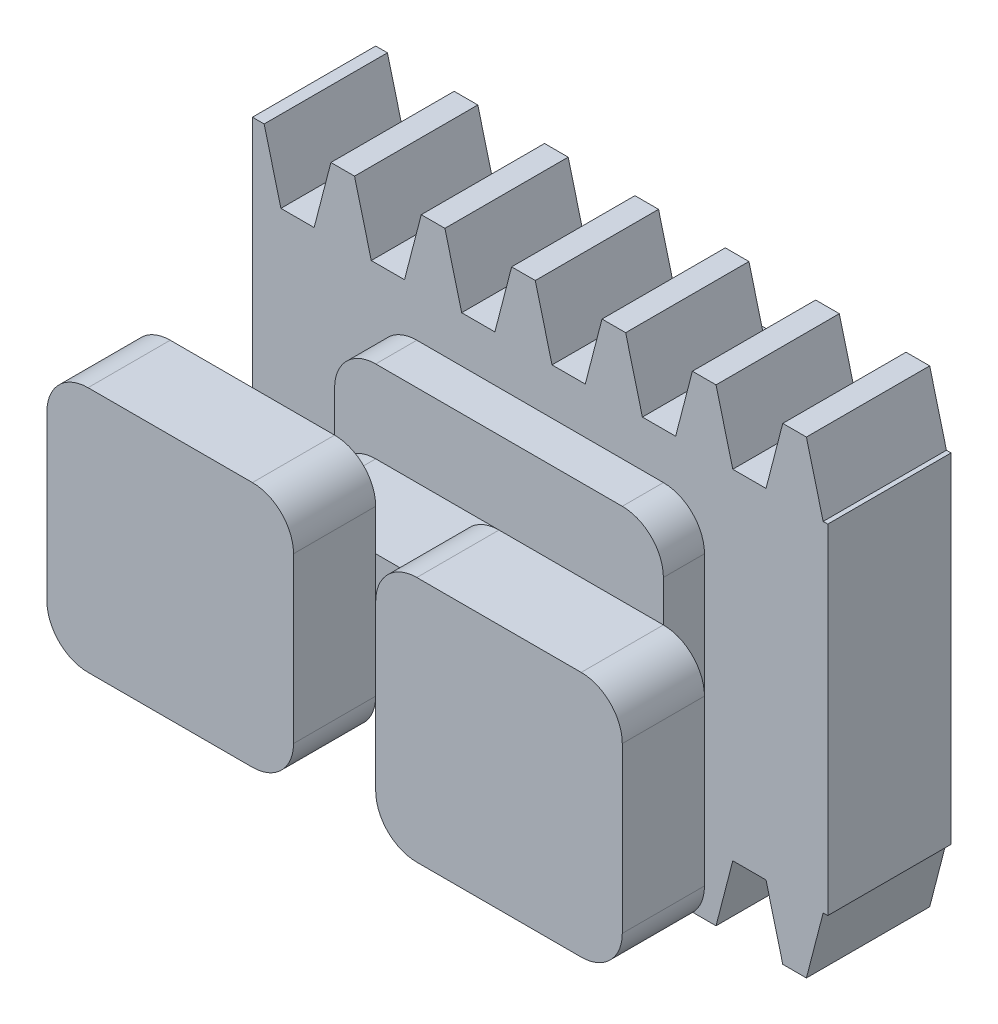
from build123d import *

# Parameters (mm, degrees)
BLANKSKE_W             = 25
BLANKSKE_H             = 5.7
BLANK_DEPTH            = 3
TOOTHCUTSIM_DEPTH      = 26.816467613
TEETHCUTS_COUNT        = 12
TEETHCUTS_PITCH        = 2.199114855
MIRROR_2_COPY_1_DEPTH  = 26.816467613
MIRROR_2_COPY_2_DEPTH  = 26.816467613
MIRROR_2_COPY_3_DEPTH  = 26.816467613
MIRROR_2_COPY_4_DEPTH  = 26.816467613
MIRROR_2_COPY_5_DEPTH  = 26.816467613
MIRROR_2_COPY_6_DEPTH  = 26.816467613
MIRROR_2_COPY_7_DEPTH  = 26.816467613
MIRROR_2_COPY_8_DEPTH  = 26.816467613
MIRROR_2_COPY_9_DEPTH  = 26.816467613
MIRROR_2_COPY_10_DEPTH = 26.816467613
MIRROR_2_COPY_11_DEPTH = 26.816467613
SKETCH_2_R             = 2
EXTRUDE_1_DEPTH        = 2.5
SKETCH_3_R             = 0.5
CUT_EXTRUDE_3_DEPTH    = 27.224797425
CUT_EXTRUDE_4_DEPTH    = 10
SKETCH_6_W             = 8
SKETCH_6_H             = 2
EXTRUDE_3_DEPTH        = 3
SKETCH_7_W             = 6
SKETCH_7_H             = 6
EXTRUDE_4_DEPTH        = 2
FILLET_1_R             = 1
FILLET_2_R             = 1
SKETCH_8_W             = 8
SKETCH_8_H             = 6
EXTRUDE_5_DEPTH        = 1
FILLET_5_R             = 1
CUT_EXTRUDE_5_DEPTH    = 24.274077912
SKETCH_10_R            = 1
CUT_EXTRUDE_6_DEPTH    = 5.5


with BuildPart() as part:
    # BlankSke → Blank (new body)
    with BuildSketch(Plane.XY):
        with Locations((12.5, 2.85)):
            Rectangle(BLANKSKE_W, BLANKSKE_H)
    blank = extrude(amount=-BLANK_DEPTH)

    # TooCutSkeSim → ToothCutSim (cut, through all)
    with BuildSketch(Plane.XY):
        Polygon((0.404488327, 4.125), (-0.404488327, 4.125), (-0.818379909, 5.7254), (0.818379909, 5.7254), align=None)
    toothcutsim = extrude(amount=-TOOTHCUTSIM_DEPTH, mode=Mode.SUBTRACT)

    # TeethCuts: ToothCutSim ×12
    with Locations(*[(i * TEETHCUTS_PITCH, 0, 0) for i in range(1, TEETHCUTS_COUNT)]):
        add(toothcutsim, mode=Mode.SUBTRACT)

    # 镜向2: Blank, ToothCutSim across plane
    add(blank.mirror(Plane(origin=(0, 0, -3), x_dir=(0, 0, 1), z_dir=(0, -1, 0))))
    add(toothcutsim.mirror(Plane(origin=(0, 0, -3), x_dir=(0, 0, 1), z_dir=(0, -1, 0))), mode=Mode.SUBTRACT)

    # 镜向2 copy 1 sketch → 镜向2 copy 1 (cut, through all)
    with BuildSketch(Plane(origin=(2.199114855, 0, 0), x_dir=(1, 0, 0), z_dir=(0, 0, 1))):
        Polygon((0.404488327, -4.125), (-0.404488327, -4.125), (-0.818379909, -5.7254), (0.818379909, -5.7254), align=None)
    extrude(amount=-MIRROR_2_COPY_1_DEPTH, mode=Mode.SUBTRACT)

    # 镜向2 copy 2 sketch → 镜向2 copy 2 (cut, through all)
    with BuildSketch(Plane(origin=(4.39822971, 0, 0), x_dir=(1, 0, 0), z_dir=(0, 0, 1))):
        Polygon((0.404488327, -4.125), (-0.404488327, -4.125), (-0.818379909, -5.7254), (0.818379909, -5.7254), align=None)
    extrude(amount=-MIRROR_2_COPY_2_DEPTH, mode=Mode.SUBTRACT)

    # 镜向2 copy 3 sketch → 镜向2 copy 3 (cut, through all)
    with BuildSketch(Plane(origin=(6.597344565, 0, 0), x_dir=(1, 0, 0), z_dir=(0, 0, 1))):
        Polygon((0.404488327, -4.125), (-0.404488327, -4.125), (-0.818379909, -5.7254), (0.818379909, -5.7254), align=None)
    extrude(amount=-MIRROR_2_COPY_3_DEPTH, mode=Mode.SUBTRACT)

    # 镜向2 copy 4 sketch → 镜向2 copy 4 (cut, through all)
    with BuildSketch(Plane(origin=(8.79645942, 0, 0), x_dir=(1, 0, 0), z_dir=(0, 0, 1))):
        Polygon((0.404488327, -4.125), (-0.404488327, -4.125), (-0.818379909, -5.7254), (0.818379909, -5.7254), align=None)
    extrude(amount=-MIRROR_2_COPY_4_DEPTH, mode=Mode.SUBTRACT)

    # 镜向2 copy 5 sketch → 镜向2 copy 5 (cut, through all)
    with BuildSketch(Plane(origin=(10.995574275, 0, 0), x_dir=(1, 0, 0), z_dir=(0, 0, 1))):
        Polygon((0.404488327, -4.125), (-0.404488327, -4.125), (-0.818379909, -5.7254), (0.818379909, -5.7254), align=None)
    extrude(amount=-MIRROR_2_COPY_5_DEPTH, mode=Mode.SUBTRACT)

    # 镜向2 copy 6 sketch → 镜向2 copy 6 (cut, through all)
    with BuildSketch(Plane(origin=(13.19468913, 0, 0), x_dir=(1, 0, 0), z_dir=(0, 0, 1))):
        Polygon((0.404488327, -4.125), (-0.404488327, -4.125), (-0.818379909, -5.7254), (0.818379909, -5.7254), align=None)
    extrude(amount=-MIRROR_2_COPY_6_DEPTH, mode=Mode.SUBTRACT)

    # 镜向2 copy 7 sketch → 镜向2 copy 7 (cut, through all)
    with BuildSketch(Plane(origin=(15.393803985, 0, 0), x_dir=(1, 0, 0), z_dir=(0, 0, 1))):
        Polygon((0.404488327, -4.125), (-0.404488327, -4.125), (-0.818379909, -5.7254), (0.818379909, -5.7254), align=None)
    extrude(amount=-MIRROR_2_COPY_7_DEPTH, mode=Mode.SUBTRACT)

    # 镜向2 copy 8 sketch → 镜向2 copy 8 (cut, through all)
    with BuildSketch(Plane(origin=(17.59291884, 0, 0), x_dir=(1, 0, 0), z_dir=(0, 0, 1))):
        Polygon((0.404488327, -4.125), (-0.404488327, -4.125), (-0.818379909, -5.7254), (0.818379909, -5.7254), align=None)
    extrude(amount=-MIRROR_2_COPY_8_DEPTH, mode=Mode.SUBTRACT)

    # 镜向2 copy 9 sketch → 镜向2 copy 9 (cut, through all)
    with BuildSketch(Plane(origin=(19.792033695, 0, 0), x_dir=(1, 0, 0), z_dir=(0, 0, 1))):
        Polygon((0.404488327, -4.125), (-0.404488327, -4.125), (-0.818379909, -5.7254), (0.818379909, -5.7254), align=None)
    extrude(amount=-MIRROR_2_COPY_9_DEPTH, mode=Mode.SUBTRACT)

    # 镜向2 copy 10 sketch → 镜向2 copy 10 (cut, through all)
    with BuildSketch(Plane(origin=(21.99114855, 0, 0), x_dir=(1, 0, 0), z_dir=(0, 0, 1))):
        Polygon((0.404488327, -4.125), (-0.404488327, -4.125), (-0.818379909, -5.7254), (0.818379909, -5.7254), align=None)
    extrude(amount=-MIRROR_2_COPY_10_DEPTH, mode=Mode.SUBTRACT)

    # 镜向2 copy 11 sketch → 镜向2 copy 11 (cut, through all)
    with BuildSketch(Plane(origin=(24.190263405, 0, 0), x_dir=(1, 0, 0), z_dir=(0, 0, 1))):
        Polygon((0.404488327, -4.125), (-0.404488327, -4.125), (-0.818379909, -5.7254), (0.818379909, -5.7254), align=None)
    extrude(amount=-MIRROR_2_COPY_11_DEPTH, mode=Mode.SUBTRACT)

    # 草图2 → 凸台-拉伸1 (add)
    with BuildSketch(Plane(origin=(0, 0, -3), x_dir=(-1, 0, 0), z_dir=(0, 0, -1))):
        with Locations((-12.5, 0)):
            Circle(SKETCH_2_R)
    extrude(amount=EXTRUDE_1_DEPTH)

    # 草图3 → 切除-拉伸3 (cut, through all)
    with BuildSketch(Plane(origin=(0, 0, -5.5), x_dir=(-1, 0, 0), z_dir=(0, 0, -1))):
        with Locations((-12.5, 0)):
            Circle(SKETCH_3_R)
    extrude(amount=-CUT_EXTRUDE_3_DEPTH, mode=Mode.SUBTRACT)

    # 草图4 → 切除-拉伸4 (cut)
    with BuildSketch(Plane(origin=(0, 0, -3), x_dir=(-1, 0, 0), z_dir=(0, 0, -1))):
        Polygon((-21.884759598, 2.149584132), (-21.884759598, -2.149584132), (-21.884759598, -6.579197657), (-25.677355537, -6.579197657), (-25.677355537, 5.959830346), (-21.884759598, 5.959830346), align=None)
        Polygon((-2.5, 4.125), (-2.5, -4.125), (-2.5, -6.073591689), (0, -6.073591689), (0, 6.402235568), (-2.5, 6.402235568), align=None)
    extrude(amount=-CUT_EXTRUDE_4_DEPTH, mode=Mode.SUBTRACT)

    # 草图6 → 凸台-拉伸3 (add)
    with BuildSketch(Plane.XY):
        with Locations((12.5, 0)):
            Rectangle(SKETCH_6_W, SKETCH_6_H)
    extrude(amount=EXTRUDE_3_DEPTH)

    # 草图7 → 凸台-拉伸4 (add)
    with BuildSketch(Plane.XY.offset(3)):
        with Locations((8.5, 0)):
            Rectangle(SKETCH_7_W, SKETCH_7_H)
        with Locations((16.5, 0)):
            Rectangle(SKETCH_7_W, SKETCH_7_H)
    extrude(amount=EXTRUDE_4_DEPTH)

    # 圆角1
    fillet_1_edges = [part.edges().sort_by_distance(p)[0] for p in [
        (16.5, -1, 1.5),
        (8.5, -1, 1.5),
        (16.5, 1, 1.5),
        (8.5, 1, 1.5),
    ]]
    fillet(fillet_1_edges, radius=FILLET_1_R - 0.0001)  # a hair under: the kernel refuses the full size

    # 圆角2
    fillet_2_edges = [part.edges().sort_by_distance(p)[0] for p in [
        (5.5, 3, 4),
        (5.5, -3, 4),
        (11.5, -3, 4),
        (11.5, 3, 4),
        (19.5, 3, 4),
        (13.5, 3, 4),
        (13.5, -3, 4),
        (19.5, -3, 4),
    ]]
    fillet(fillet_2_edges, radius=FILLET_2_R)

    # 草图8 → 凸台-拉伸5 (add)
    with BuildSketch(Plane.XY):
        with Locations((12.5, 0)):
            Rectangle(SKETCH_8_W, SKETCH_8_H)
    extrude(amount=EXTRUDE_5_DEPTH)

    # 圆角5
    fillet_5_edges = [part.edges().sort_by_distance(p)[0] for p in [
        (16.5, -3, 0.5),
        (8.5, 3, 0.5),
        (16.5, 3, 0.5),
        (8.5, -3, 0.5),
    ]]
    fillet(fillet_5_edges, radius=FILLET_5_R)

    # 草图9 → 切除-拉伸5 (cut, through all)
    with BuildSketch(Plane.XY):
        Polygon((5.5, 0), (5.5, -6.223195751), (2.23821655, -6.223195751), (2.23821655, 6.249606369), (5.5, 6.249606369), align=None)
        Polygon((19.5, 0), (19.5, -6.223195751), (22.40634716, -6.223195751), (22.40634716, 6.249606369), (19.5, 6.249606369), align=None)
    extrude(amount=-CUT_EXTRUDE_5_DEPTH, mode=Mode.SUBTRACT)

    # 草图10 → 切除-拉伸6 (cut)
    with BuildSketch(Plane(origin=(0, 0, -5.5), x_dir=(-1, 0, 0), z_dir=(0, 0, -1))):
        with Locations((-12.5, 0)):
            Circle(SKETCH_10_R)
    extrude(amount=-CUT_EXTRUDE_6_DEPTH, mode=Mode.SUBTRACT)


solid = part.part
